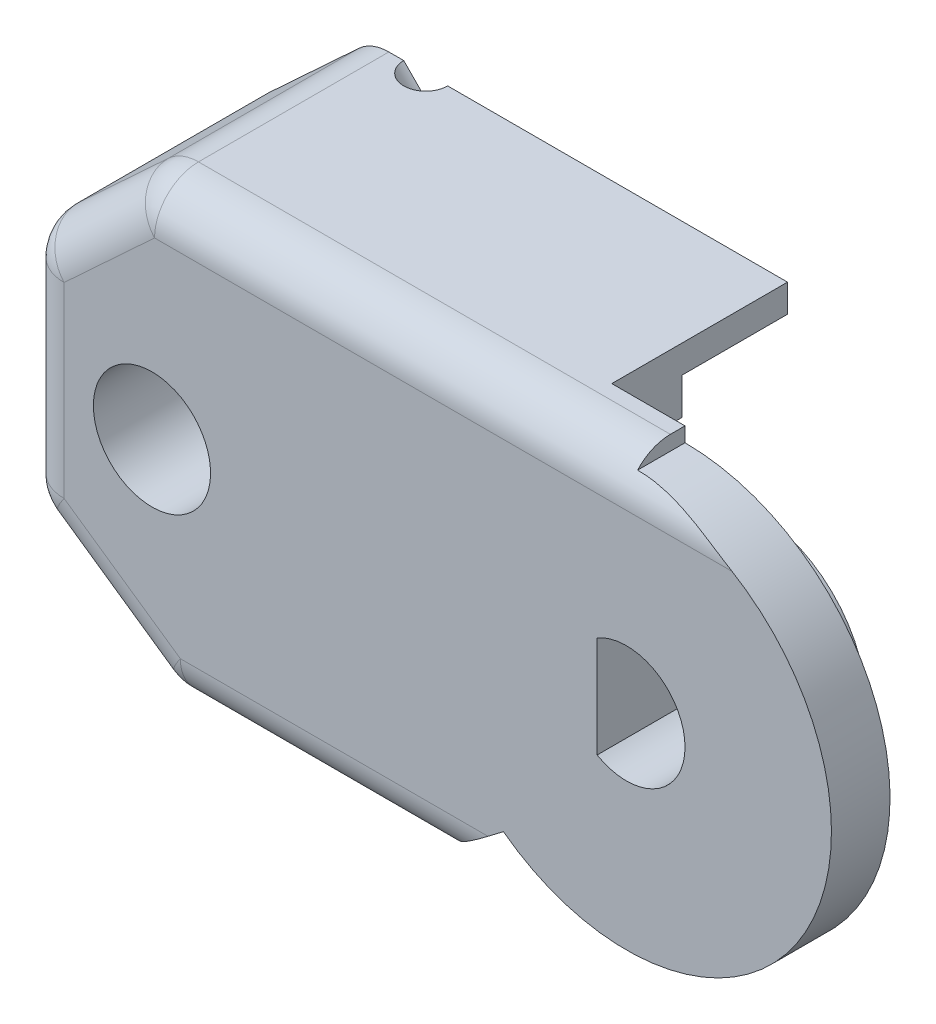
from build123d import *

# Parameters (mm, degrees)
BOSS_EXTRUDE1_DEPTH = 2
BOSS_EXTRUDE2_DEPTH = 6
SKETCH24_R          = 3.9
BOSS_EXTRUDE5_DEPTH = 2.3
SKETCH30_W          = 2.408612022
SKETCH30_H          = 1.324178481
CUT_EXTRUDE12_DEPTH = 8
CUT_EXTRUDE11_DEPTH = 23.432788503
FILLET1_R           = 1.5
SKETCH34_R          = 0.75
CUT_EXTRUDE13_DEPTH = 8
SKETCH35_R          = 0.75
CUT_EXTRUDE14_DEPTH = 8
SKETCH36_R          = 0.95
CUT_EXTRUDE15_DEPTH = 8
SKETCH37_R          = 2
CUT_EXTRUDE16_DEPTH = 5
SKETCH38_W          = 4.196291048
SKETCH38_H          = 1.25
CUT_EXTRUDE17_DEPTH = 3.6


with BuildPart() as part:
    # Sketch2 → Boss-Extrude1 (new body)
    with BuildSketch(Plane.XY):
        with BuildLine():
            Line((-2.5, 7.5), (-16.7, 7.5))
            Line((-16.7, 7.5), (-20.7, 3.793442666))
            Line((-20.7, 3.793442666), (-20.7, -4.031648778))
            Line((-20.7, -4.031648778), (-15.7, -7.5))
            Line((-15.7, -7.5), (-6.7, -7.5))
            Line((-6.7, -7.5), (-4.2, -5.6))
            ThreePointArc((-4.2, -5.6), (3.130495168, -6.260990337), (7, 0))
            ThreePointArc((7, 0), (4.949747468, 4.949747468), (0, 7))
            Line((0, 7), (0, 7.5))
            Line((0, 7.5), (-2.5, 7.5))
        make_face()
    extrude(amount=BOSS_EXTRUDE1_DEPTH)

    # Sketch4 → Boss-Extrude2 (add)
    with BuildSketch(Plane.XY.offset(2)):
        Polygon((-15.7, -7.5), (-6.7, -7.5), (-6.759079174, -4.5), (-12.2, -4.5), (-12.2, 2), (-6.696291048, 2), (-6.696291048, 5.3), (-2.5, 5.3), (-2.5, 7.5), (-16.7, 7.5), (-20.7, 3.793442666), (-20.7, -4.031648778), align=None)
    extrude(amount=BOSS_EXTRUDE2_DEPTH)

    # Sketch24 → Boss-Extrude5 (add)
    with BuildSketch(Plane.XY.offset(2)):
        Circle(SKETCH24_R)
    extrude(amount=BOSS_EXTRUDE5_DEPTH)

    # Sketch30 → Cut-Extrude12 (cut)
    with BuildSketch(Plane(origin=(-6.696291048, 0, 0), x_dir=(0, 0, -1), z_dir=(1, 0, 0))):
        with Locations((-3.261593395, 4.63791076)):
            Rectangle(SKETCH30_W, SKETCH30_H)
    extrude(amount=-CUT_EXTRUDE12_DEPTH, mode=Mode.SUBTRACT)

    # Sketch28 → Cut-Extrude11 (cut, through all)
    with BuildSketch(Plane.XY.offset(4.3)):
        with BuildLine():
            Line((-1, 1.732050808), (-1, -1.732050808))
            ThreePointArc((-1, -1.732050808), (2, 0), (-1, 1.732050808))
        make_face()
    extrude(amount=-CUT_EXTRUDE11_DEPTH, mode=Mode.SUBTRACT)

    # Fillet1
    fillet1_edges = [part.edges().sort_by_distance(p)[0] for p in [
        (-11.2, -7.5, 0),
        (-8.35, 7.5, 0),
        (-18.7, 5.646721333, 0),
        (-18.2, -5.765824389, 0),
        (-20.7, -0.119103056, 0),
        (-15.7, -7.5, 4),
        (-20.7, -4.031648778, 4),
        (-20.7, 3.793442666, 4),
        (-16.7, 7.5, 4),
    ]]
    fillet(fillet1_edges, radius=FILLET1_R)

    # Sketch34 → Cut-Extrude13 (cut, along a direction that is not the sketch's normal)
    with BuildSketch(Plane.XZ.offset(-2)):
        with Locations((-9.448145524, 8)):
            Circle(SKETCH34_R)
    extrude(amount=-CUT_EXTRUDE13_DEPTH, dir=(0.7008928237726356, -0.7132666048428324, 0), mode=Mode.SUBTRACT)

    # Sketch35 → Cut-Extrude14 (cut, along a direction that is not the sketch's normal)
    with BuildSketch(Plane(origin=(0, -4.5, 0), x_dir=(1, 0, 0), z_dir=(0, 1, 0))):
        with Locations((-10.483626668, -8)):
            Circle(SKETCH35_R)
    extrude(amount=-CUT_EXTRUDE14_DEPTH, dir=(0.5999194182208608, 0.8000604299935998, 0), mode=Mode.SUBTRACT)

    # Sketch36 → Cut-Extrude15 (cut)
    with BuildSketch(Plane.XY.offset(8)):
        with Locations((-16.2, 0)):
            Circle(SKETCH36_R)
    extrude(amount=-CUT_EXTRUDE15_DEPTH, mode=Mode.SUBTRACT)

    # Sketch37 → Cut-Extrude16 (cut)
    with BuildSketch(Plane(origin=(0, 0, 0), x_dir=(-1, 0, 0), z_dir=(0, 0, -1))):
        with Locations((16.2, 0)):
            Circle(SKETCH37_R)
    extrude(amount=-CUT_EXTRUDE16_DEPTH, mode=Mode.SUBTRACT)

    # Sketch38 → Cut-Extrude17 (cut)
    with BuildSketch(Plane.XY.offset(8)):
        with Locations((-4.598145524, 5.925)):
            Rectangle(SKETCH38_W, SKETCH38_H)
    extrude(amount=-CUT_EXTRUDE17_DEPTH, mode=Mode.SUBTRACT)

    # Mirror1: part across plane


with BuildPart() as part_1:
    add(part.part)
    add(part.part.mirror(Plane.XY.offset(8)))


with BuildPart() as body_2:
    # Split1: the piece on the far side of the plane
    add(part_1.part)
    split(bisect_by=Plane.XY.offset(8), keep=Keep.BOTTOM)


with BuildPart() as part_2:
    add(part_1.part)

    # Split1
    split(bisect_by=Plane.XY.offset(8), keep=Keep.TOP)


solid = part_2.part
